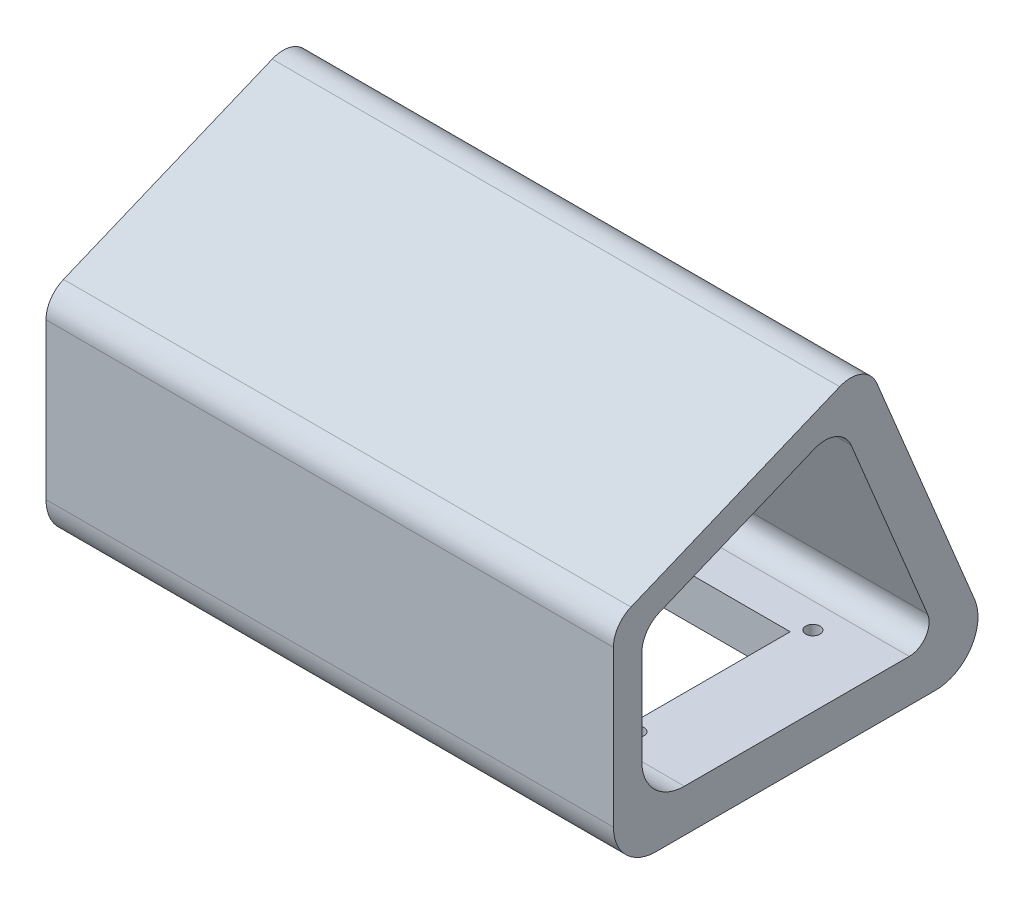
from build123d import *

# Parameters (mm, degrees)
SKETCH1_W               = 100
SKETCH1_H               = 65.435021842
SKETCH1_R               = 1.2499975
SKETCH1_W_2             = 71.5
SKETCH1_H_2             = 26.5
BOSS_EXTRUDE1_DEPTH     = 7.5
MIRROR2_OUTLINE_R       = 1.2499975
MIRROR2_DEPTH           = 7.5
MIRROR3_OUTLINE_R       = 1.2499975
MIRROR3_DEPTH           = 7.5
BOSS_EXTRUDE2_DEPTH     = 100
FILLET2_R               = 7.5
CUT_EXTRUDE2_DEPTH      = 116.441064867
CUT_EXTRUDE2_DEPTH_BACK = 116.441064867
SKETCH5_W               = 7.5
SKETCH5_H               = 10.864122905
BOSS_EXTRUDE3_DEPTH     = 100
FILLET4_R               = 3.5
FILLET5_R               = 7.5
FILLET6_R               = 5


# Read off the part's stored shape, not the designer's step: Mirror2, Mirror3
with BuildPart() as part:
    # Sketch1 → Boss-Extrude1 (new body)
    with BuildSketch(Plane(origin=(0, 0, 0), x_dir=(1, 0, 0), z_dir=(0, 1, 0))):
        Rectangle(SKETCH1_W, SKETCH1_H)
        with Locations(Location((-37.5, 15.499999988, 0), (0, 0, 270))):
            Circle(SKETCH1_R, mode=Mode.SUBTRACT)
        Rectangle(SKETCH1_W_2, SKETCH1_H_2, mode=Mode.SUBTRACT)
    extrude(amount=BOSS_EXTRUDE1_DEPTH)

    # Mirror2 outline → Mirror2 (cut)
    with BuildSketch(Plane(origin=(0, 0, 0), x_dir=(1, 0, 0), z_dir=(0, 1, 0))):
        with Locations((37.5, 15.499999988)):
            Circle(MIRROR2_OUTLINE_R)
    extrude(amount=MIRROR2_DEPTH, mode=Mode.SUBTRACT)

    # Mirror3 outline → Mirror3 (cut)
    with BuildSketch(Plane(origin=(0, 0, 0), x_dir=(1, 0, 0), z_dir=(0, 1, 0))):
        with Locations((-37.5, -15.499999988)):
            Circle(MIRROR3_OUTLINE_R)
        with Locations((37.5, -15.499999988)):
            Circle(MIRROR3_OUTLINE_R)
    extrude(amount=MIRROR3_DEPTH, mode=Mode.SUBTRACT)

    # Sketch4 → Boss-Extrude2 (add)
    with BuildSketch(Plane(origin=(50, 0, 0), x_dir=(0, 0, -1), z_dir=(1, 0, 0))):
        Polygon((28.324112639, 0), (8.64916927, 47.499515121), (16.14916927, 47.499515121), (32.717510921, 7.5), (35.824112639, 0), align=None)
    extrude(amount=-BOSS_EXTRUDE2_DEPTH)

    # Fillet2
    fillet2_edges = [part.edges().sort_by_distance(p)[0] for p in [
        (0, 0, -35.824112639),
    ]]
    fillet(fillet2_edges, radius=FILLET2_R)

    # Sketch5 → Cut-Extrude2 (cut, two sides: drawn at the far end of the back side and taken through both)
    with BuildSketch(Plane(origin=(50, 0, 0), x_dir=(0, 0, -1), z_dir=(1, 0, 0)).offset(-CUT_EXTRUDE2_DEPTH_BACK)):
        with Locations((-30.896013204, 2.067938548)):
            Rectangle(SKETCH5_W, SKETCH5_H)
    extrude(amount=CUT_EXTRUDE2_DEPTH + CUT_EXTRUDE2_DEPTH_BACK, mode=Mode.SUBTRACT)

    # Sketch6 → Boss-Extrude3 (add)
    with BuildSketch(Plane(origin=(50, 0, 0), x_dir=(0, 0, -1), z_dir=(1, 0, 0))):
        Polygon((-27.146013204, 0), (-32.146013204, 0), (-32.146013204, 38.274911515), (12.337893428, 56.700748949), (13.485305965, 53.930650039), (16.14916927, 47.499515121), (12.93914216, 38.274911515), (8.66493866, 47.461444446), (7.84966016, 49.429700857), (-27.146013204, 34.934018325), align=None)
    extrude(amount=-BOSS_EXTRUDE3_DEPTH)

    # Fillet4
    fillet4_edges = [part.edges().sort_by_distance(p)[0] for p in [
        (0, 7.5, -25.217510921),
    ]]
    fillet(fillet4_edges, radius=FILLET4_R)

    # Fillet5
    fillet5_edges = [part.edges().sort_by_distance(p)[0] for p in [
        (0, 7.5, 27.146013204),
        (0, 0, 32.146013204),
    ]]
    fillet(fillet5_edges, radius=FILLET5_R)

    # Fillet6
    fillet6_edges = [part.edges().sort_by_distance(p)[0] for p in [
        (0, 34.934018325, 27.146013204),
        (0, 38.274911515, 32.146013204),
        (0, 56.700748949, -12.337893428),
        (0, 49.429700857, -7.84966016),
    ]]
    fillet(fillet6_edges, radius=FILLET6_R)


solid = part.part
